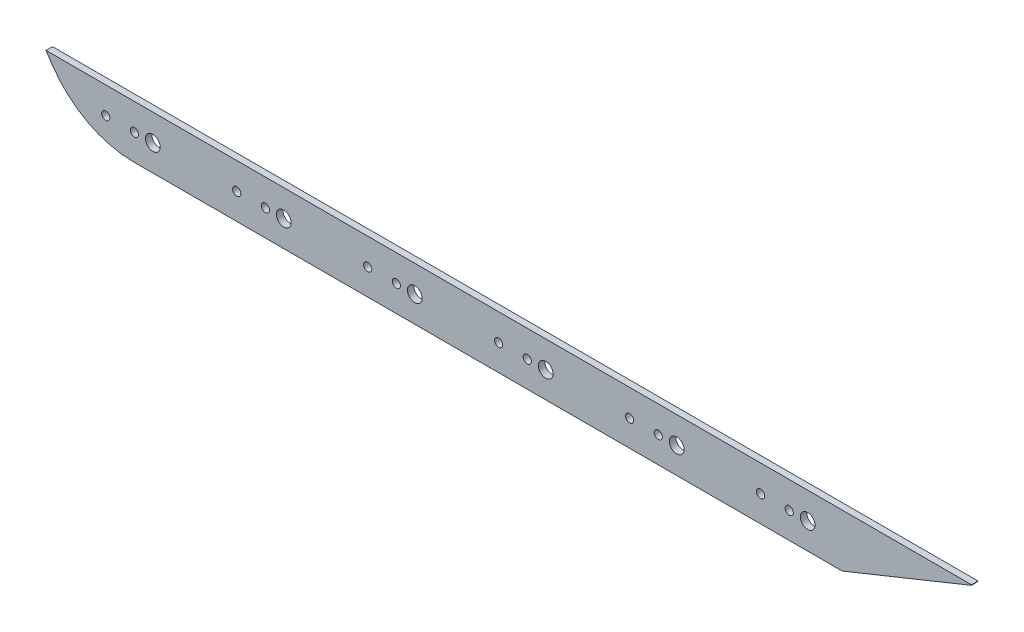
from build123d import *

# Parameters (mm, degrees)
BOSS_EXTRUDE1_DEPTH = 3.175
SKETCH1_4_R         = 3.6
CUT_EXTRUDE1_DEPTH  = 439.905857431
FILLET1_R           = 48
CUT_EXTRUDE3_DEPTH  = 10
CUT_EXTRUDE5_DEPTH  = 10
SKETCH13_R          = 2
CUT_EXTRUDE6_DEPTH  = 10


with BuildPart() as part:
    # Sketch1 → Boss-Extrude1 (new body)
    with BuildSketch(Plane.XY):
        Polygon((428.120588235, 28.939617947), (0.540381846, 28.939617947), (-115.605170134, 28.939617947), (-98.879411765, 3.850980392), (-31.879411765, -96.649019608), (366, -96.649019608), (403.120588235, -71.149019608), align=None)
    extrude(amount=BOSS_EXTRUDE1_DEPTH)

    # Sketch1<4> → Cut-Extrude1 (cut, through all)
    with BuildSketch(Plane.XY):
        with Locations((3.120588235, -83.899019608)):
            Circle(SKETCH1_4_R)
        with Locations((67.120588235, -83.899019608)):
            Circle(SKETCH1_4_R)
        with Locations((131.120588235, -83.899019608)):
            Circle(SKETCH1_4_R)
        with Locations((195.120588235, -83.899019608)):
            Circle(SKETCH1_4_R)
        with Locations((259.120588235, -83.899019608)):
            Circle(SKETCH1_4_R)
        with Locations((323.120588235, -83.899019608)):
            Circle(SKETCH1_4_R)
    extrude(amount=CUT_EXTRUDE1_DEPTH, mode=Mode.SUBTRACT)

    # Fillet1
    fillet1_edges = [part.edges().sort_by_distance(p)[0] for p in [
        (-31.879411765, -96.649019608, 1.5875),
    ]]
    fillet(fillet1_edges, radius=FILLET1_R)

    # Sketch7 → Cut-Extrude3 (cut)
    with BuildSketch(Plane.XY.offset(3.175)):
        Polygon((403.120588235, -71.149019608), (340.005873473, -96.649019608), (366, -96.649019608), align=None)
    extrude(amount=-CUT_EXTRUDE3_DEPTH, mode=Mode.SUBTRACT)

    # Sketch11 → Cut-Extrude5 (cut)
    with BuildSketch(Plane.XY.offset(3.175)):
        Polygon((-49.086078431, -70.839019608), (403.198019602, -70.839019608), (428.120588235, 28.939617947), (-115.605170134, 28.939617947), align=None)
    extrude(amount=-CUT_EXTRUDE5_DEPTH, mode=Mode.SUBTRACT)

    # Sketch13 → Cut-Extrude6 (cut)
    with BuildSketch(Plane(origin=(0, 0, 0), x_dir=(-1, 0, 0), z_dir=(0, 0, -1))):
        with Locations((-58.120593324, -83.886258845)):
            Circle(SKETCH13_R)
        with Locations((-44.120593324, -83.886258845)):
            Circle(SKETCH13_R)
        with Locations((5.879411765, -83.886258845)):
            Circle(SKETCH13_R)
        with Locations((19.879411765, -83.886258845)):
            Circle(SKETCH13_R)
        with Locations((-122.120588235, -83.899019608)):
            Circle(SKETCH13_R)
        with Locations((-108.120588235, -83.899019608)):
            Circle(SKETCH13_R)
        with Locations((-186.120588235, -83.899019608)):
            Circle(SKETCH13_R)
        with Locations((-172.120588235, -83.899019608)):
            Circle(SKETCH13_R)
        with Locations((-250.120588235, -83.899019608)):
            Circle(SKETCH13_R)
        with Locations((-236.120588235, -83.899019608)):
            Circle(SKETCH13_R)
        with Locations((-314.120588235, -83.899019608)):
            Circle(SKETCH13_R)
        with Locations((-300.120588235, -83.899019608)):
            Circle(SKETCH13_R)
    extrude(amount=-CUT_EXTRUDE6_DEPTH, mode=Mode.SUBTRACT)


solid = part.part
